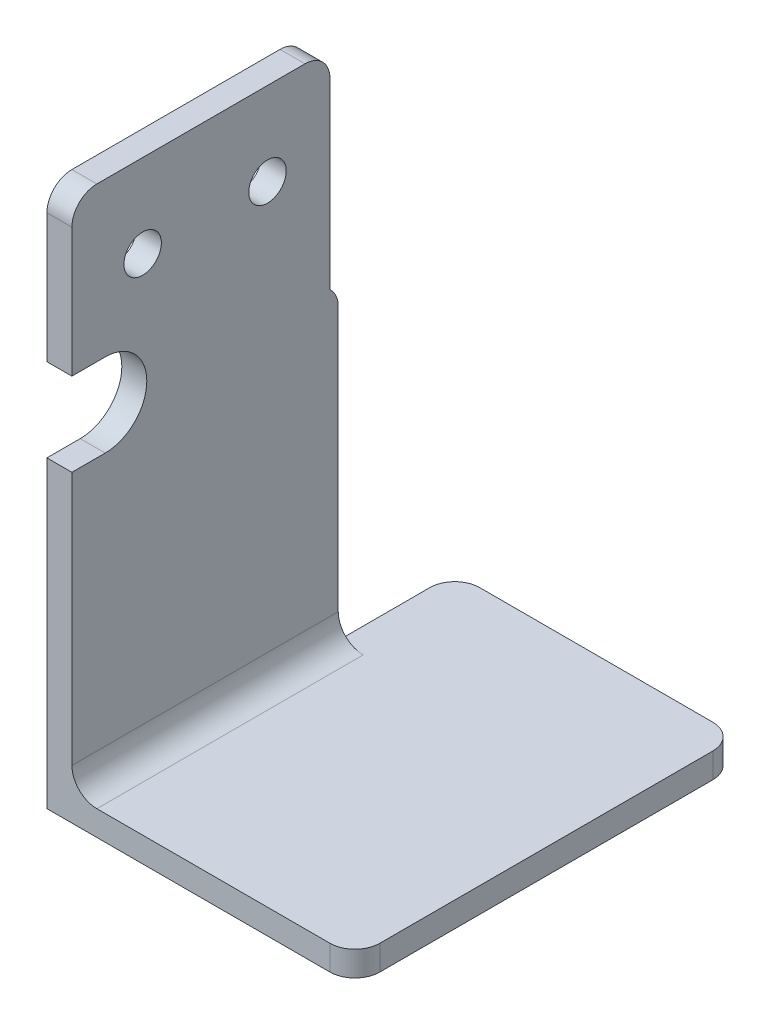
from build123d import *

# Parameters (mm, degrees)
BOSS_EXTRUDE1_DEPTH = 46
CUT_EXTRUDE1_DEPTH  = 3
SKETCH3_R           = 2.25
CUT_EXTRUDE2_DEPTH  = 46
FILLET1_R           = 3


with BuildPart() as part:
    # Sketch1 → Boss-Extrude1 (new body)
    with BuildSketch(Plane.XY):
        Polygon((0, 0), (0, 65), (3, 65), (3, 3), (37, 3), (37, 0), align=None)
    extrude(amount=BOSS_EXTRUDE1_DEPTH)

    # Sketch2 → Cut-Extrude1 (cut)
    with BuildSketch(Plane.ZY):
        Polygon((0, 65), (14, 65), (15, 65), (15, 40), (14, 40), (14, 0), (0, 0), align=None)
        with BuildLine():
            Line((42, 46.5), (46, 46.5))
            Line((46, 46.5), (46, 36.5))
            Line((46, 36.5), (42, 36.5))
            ThreePointArc((42, 36.5), (37, 41.5), (42, 46.5))
        make_face()
    extrude(amount=-CUT_EXTRUDE1_DEPTH, mode=Mode.SUBTRACT)

    # Sketch3 → Cut-Extrude2 (cut)
    with BuildSketch(Plane(origin=(3, 0, 0), x_dir=(0, 0, -1), z_dir=(1, 0, 0))):
        with Locations(Location((-37.5, 55, 0), (0, 0, 90))):
            Circle(SKETCH3_R)
        with Locations(Location((-22.5, 55, 0), (0, 0, 90))):
            Circle(SKETCH3_R)
    extrude(amount=-CUT_EXTRUDE2_DEPTH, mode=Mode.SUBTRACT)

    # Fillet1
    # the kernel refuses this fillet: 3 mm, written as the material it adds along each edge
    with BuildSketch(Plane(origin=(3, 3, 14), x_dir=(0, 1, 0), z_dir=(0, 0, 1))) as fillet1_piece_1:
        with BuildLine():
            CenterArc((FILLET1_R, -FILLET1_R), FILLET1_R, 90, 90)
            Line((0, -FILLET1_R), (0, 0))
            Line((0, 0), (FILLET1_R, 0))
        make_face()
    extrude(amount=32)
    # the kernel refuses this fillet: 3 mm, written as the material it takes off along each edge
    with BuildSketch(Plane(origin=(-5.590169944, 40, 14), x_dir=(0, -1, 0), z_dir=(1, 0, 0))) as fillet1_2_piece_1:
        with BuildLine():
            CenterArc((2.236067977, -3), FILLET1_R, 90, 48.189685104)
            Line((0, -1), (0, 0))
            Line((0, 0), (2.236067977, 0))
        make_face()
    extrude(amount=14.180339887, mode=Mode.SUBTRACT)
    with BuildSketch(Plane(origin=(37, 10.5, 46), x_dir=(-1, 0, 0), z_dir=(0, -1, 0)), Plane(origin=(3, -7.5, 0), x_dir=(0, 0, 1), z_dir=(0, 1, 0))) as fillet1_2_piece_2:
        with BuildLine():
            CenterArc((FILLET1_R, FILLET1_R), FILLET1_R, 180, 90)
            Line((0, FILLET1_R), (0, 0))
            Line((0, 0), (FILLET1_R, 0))
        make_face()
    extrude(amount=18, mode=Mode.SUBTRACT)
    with BuildSketch(Plane(origin=(37, 10.5, 0), x_dir=(-1, 0, 0), z_dir=(0, -1, 0)), Plane(origin=(-7.5, 65, 46), x_dir=(0, 0, -1), z_dir=(1, 0, 0)), Plane(origin=(-7.5, 65, 15), x_dir=(0, -1, 0), z_dir=(1, 0, 0))) as fillet1_2_piece_3:
        with BuildLine():
            CenterArc((FILLET1_R, -FILLET1_R), FILLET1_R, 90, 90)
            Line((0, -FILLET1_R), (0, 0))
            Line((0, 0), (FILLET1_R, 0))
        make_face()
    extrude(amount=18, mode=Mode.SUBTRACT)


solid = part.part
